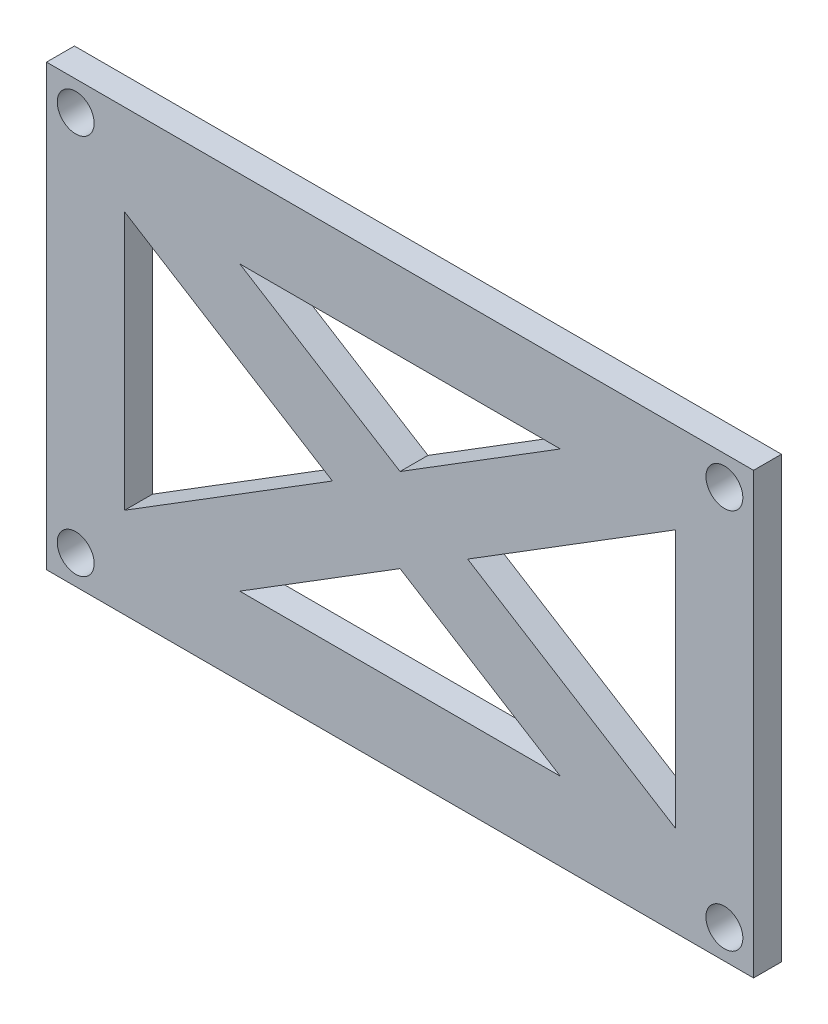
from build123d import *

# Parameters (mm, degrees)
SKETCH2_W           = 40.2336
SKETCH2_H           = 25.019
SKETCH2_R           = 1.05
BOSS_EXTRUDE1_DEPTH = 1.5875


with BuildPart() as part:
    # Sketch2 → Boss-Extrude1 (new body)
    with BuildSketch(Plane.XY):
        Rectangle(SKETCH2_W, SKETCH2_H)
        with Locations((-18.4568, 10.8495)):
            Circle(SKETCH2_R, mode=Mode.SUBTRACT)
        with Locations((-18.4568, -10.8495)):
            Circle(SKETCH2_R, mode=Mode.SUBTRACT)
        with Locations((18.4568, -10.8495)):
            Circle(SKETCH2_R, mode=Mode.SUBTRACT)
        with Locations((18.4568, 10.8495)):
            Circle(SKETCH2_R, mode=Mode.SUBTRACT)
        Polygon((15.6718, -7.352568033), (3.847974859, 0), (15.6718, 7.352568033), align=None, mode=Mode.SUBTRACT)
        Polygon((9.120723619, -8.0645), (0, -2.392837901), (-9.120723619, -8.0645), align=None, mode=Mode.SUBTRACT)
        Polygon((9.120723619, 8.0645), (-9.120723619, 8.0645), (0, 2.392837901), align=None, mode=Mode.SUBTRACT)
        Polygon((-15.6718, 7.352568033), (-15.6718, -7.352568033), (-3.847974859, 0), align=None, mode=Mode.SUBTRACT)
    extrude(amount=BOSS_EXTRUDE1_DEPTH)


solid = part.part
